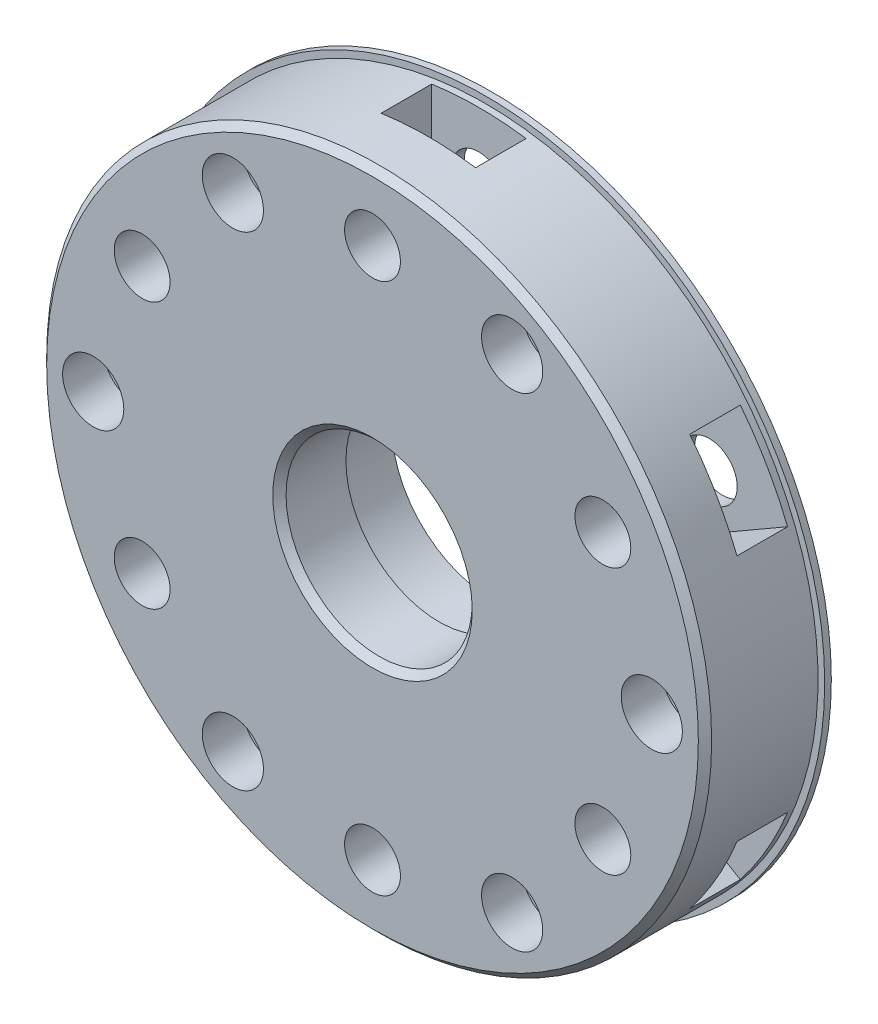
from build123d import *

# Parameters (mm, degrees)
OUTPUT_MASTER_SKETCH_R  = 25
BOSS_EXTRUDE1_DEPTH     = 9
SKETCH4_R               = 3.05
CUT_EXTRUDE1_DEPTH      = 4
SKETCH5_R               = 25.5
SKETCH5_R_2             = 25
BOSS_EXTRUDE2_DEPTH     = 0.5
SKETCH6_R               = 1.55
CUT_EXTRUDE2_DEPTH      = 38.16853508
SKETCH7_R               = 2.3
CUT_EXTRUDE3_DEPTH      = 3.1
CHAMFER1_SIZE           = 0.5
SKETCH8_R               = 7
CUT_EXTRUDE4_DEPTH      = 10
SKETCH9_R               = 7.55
CUT_EXTRUDE5_DEPTH      = 4
SKETCH10_R              = 2.1
M4_THRU_DEPTH           = 38.16853508
CHAMFER3_SIZE           = 0.5
M4_START                = -8
M4_HEXNUT_CUT_DEPTH     = 3.8
SKETCH12_W              = 7.1
SKETCH12_H              = 3.8
M4_HEXNUT_SLOT_DEPTH    = 55.701131961
M4_HEXNUT_PATTERN_COUNT = 6


with BuildPart() as part:
    # Output Master Sketch → Boss-Extrude1 (new body)
    with BuildSketch(Plane.XY):
        Circle(OUTPUT_MASTER_SKETCH_R)
    extrude(amount=BOSS_EXTRUDE1_DEPTH)

    # Sketch4 → Cut-Extrude1 (cut)
    with BuildSketch(Plane.XY):
        with Locations((21, 0)):
            Circle(SKETCH4_R)
        with Locations((10.5, -18.186533479)):
            Circle(SKETCH4_R)
        with Locations((-10.5, -18.186533479)):
            Circle(SKETCH4_R)
        with Locations((-21, 0)):
            Circle(SKETCH4_R)
        with Locations((-10.5, 18.186533479)):
            Circle(SKETCH4_R)
        with Locations((10.5, 18.186533479)):
            Circle(SKETCH4_R)
    extrude(amount=CUT_EXTRUDE1_DEPTH, mode=Mode.SUBTRACT)

    # Sketch5 → Boss-Extrude2 (add)
    with BuildSketch(Plane(origin=(0, 0, 0), x_dir=(-1, 0, 0), z_dir=(0, 0, -1))):
        Circle(SKETCH5_R)
        Circle(SKETCH5_R_2, mode=Mode.SUBTRACT)
    extrude(amount=-BOSS_EXTRUDE2_DEPTH)

    # Sketch6 → Cut-Extrude2 (cut, through all)
    with BuildSketch(Plane(origin=(0, 0, 0), x_dir=(-1, 0, 0), z_dir=(0, 0, -1))):
        with Locations((-21, 0)):
            Circle(SKETCH6_R)
        with Locations((-10.5, 18.186533479)):
            Circle(SKETCH6_R)
        with Locations((10.5, 18.186533479)):
            Circle(SKETCH6_R)
        with Locations((21, 0)):
            Circle(SKETCH6_R)
        with Locations((10.5, -18.186533479)):
            Circle(SKETCH6_R)
        with Locations((-10.5, -18.186533479)):
            Circle(SKETCH6_R)
    extrude(amount=-CUT_EXTRUDE2_DEPTH, mode=Mode.SUBTRACT)

    # Sketch7 → Cut-Extrude3 (cut)
    with BuildSketch(Plane.XY.offset(9)):
        with Locations((-21, 0)):
            Circle(SKETCH7_R)
        with Locations((-10.5, 18.186533479)):
            Circle(SKETCH7_R)
        with Locations((10.5, 18.186533479)):
            Circle(SKETCH7_R)
        with Locations((21, 0)):
            Circle(SKETCH7_R)
        with Locations((10.5, -18.186533479)):
            Circle(SKETCH7_R)
        with Locations((-10.5, -18.186533479)):
            Circle(SKETCH7_R)
    extrude(amount=-CUT_EXTRUDE3_DEPTH, mode=Mode.SUBTRACT)

    # Chamfer1
    chamfer1_edges = [part.edges().sort_by_distance(p)[0] for p in [
        (-25, 0, 9),
    ]]
    chamfer(chamfer1_edges, length=CHAMFER1_SIZE)

    # Sketch8 → Cut-Extrude4 (cut)
    with BuildSketch(Plane(origin=(0, 0, 0), x_dir=(-1, 0, 0), z_dir=(0, 0, -1))):
        Circle(SKETCH8_R)
    extrude(amount=-CUT_EXTRUDE4_DEPTH, mode=Mode.SUBTRACT)

    # Sketch9 → Cut-Extrude5 (cut)
    with BuildSketch(Plane(origin=(0, 0, 0), x_dir=(-1, 0, 0), z_dir=(0, 0, -1))):
        Circle(SKETCH9_R)
    extrude(amount=-CUT_EXTRUDE5_DEPTH, mode=Mode.SUBTRACT)

    # Sketch10 → M4 Thru (cut, through all)
    with BuildSketch(Plane.XY.offset(9)):
        with Locations((0, 20)):
            Circle(SKETCH10_R)
        with Locations((17.320508076, 10)):
            Circle(SKETCH10_R)
        with Locations((17.320508076, -10)):
            Circle(SKETCH10_R)
        with Locations((0, -20)):
            Circle(SKETCH10_R)
        with Locations((-17.320508076, -10)):
            Circle(SKETCH10_R)
        with Locations((-17.320508076, 10)):
            Circle(SKETCH10_R)
    extrude(amount=-M4_THRU_DEPTH, mode=Mode.SUBTRACT)

    # Chamfer3
    chamfer3_edges = [part.edges().sort_by_distance(p)[0] for p in [
        (7, 0, 9),
    ]]
    chamfer(chamfer3_edges, length=CHAMFER3_SIZE)

    # Sketch11 → M4 Hexnut Cut (cut)
    with BuildSketch(Plane.XY.offset(9).offset(M4_START)):
        Polygon((0, 24.099186911), (-3.55, 22.049593456), (-3.55, 17.950406544), (0, 15.900813089), (3.55, 17.950406544), (3.55, 22.049593456), align=None)
    m4_hexnut_cut = extrude(amount=M4_HEXNUT_CUT_DEPTH, mode=Mode.SUBTRACT)

    # Sketch12 → M4 Hexnut Slot (cut, through all)
    with BuildSketch(Plane(origin=(0, 22.049593456, 0), x_dir=(1, 0, 0), z_dir=(0, 1, 0))):
        with Locations((0, -2.9)):
            Rectangle(SKETCH12_W, SKETCH12_H)
    m4_hexnut_slot = extrude(amount=M4_HEXNUT_SLOT_DEPTH, mode=Mode.SUBTRACT)

    # M4 Hexnut Pattern: M4 Hexnut Cut, M4 Hexnut Slot ×6 about axis
    m4_hexnut_pattern_axis = Axis((0, 0, 10), (0, 0, -1))
    add([m4_hexnut_cut.rotate(m4_hexnut_pattern_axis, i * 360 / M4_HEXNUT_PATTERN_COUNT) for i in range(1, M4_HEXNUT_PATTERN_COUNT)], mode=Mode.SUBTRACT)
    add([m4_hexnut_slot.rotate(m4_hexnut_pattern_axis, i * 360 / M4_HEXNUT_PATTERN_COUNT) for i in range(1, M4_HEXNUT_PATTERN_COUNT)], mode=Mode.SUBTRACT)


solid = part.part
